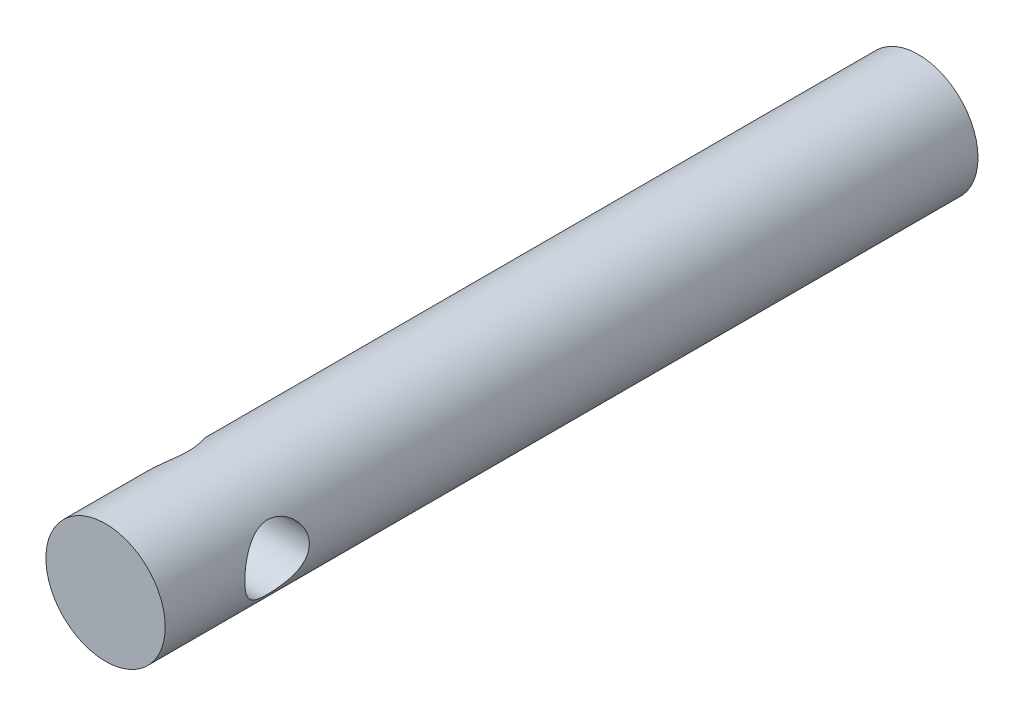
from build123d import *

# Parameters (mm, degrees)
SKETCH1_R           = 4
BOSS_EXTRUDE1_DEPTH = 54.5
SKETCH2_R           = 2.165
CUT_EXTRUDE1_DEPTH  = 9
SKETCH4_R           = 3.5
CUT_EXTRUDE2_DEPTH  = 55.792791611


with BuildPart() as part:
    # Sketch1 → Boss-Extrude1 (new body)
    with BuildSketch(Plane.XY):
        Circle(SKETCH1_R)
    extrude(amount=BOSS_EXTRUDE1_DEPTH)

    # Sketch2 → Cut-Extrude1 (cut, symmetric)
    with BuildSketch(Plane(origin=(0, 0, 0), x_dir=(0, 0, -1), z_dir=(1, 0, 0))):
        with Locations((-47, 0)):
            Circle(SKETCH2_R)
    extrude(amount=CUT_EXTRUDE1_DEPTH, both=True, mode=Mode.SUBTRACT)

    # Sketch4 → Cut-Extrude2 (cut, through all)
    with BuildSketch(Plane(origin=(0, 0, 0), x_dir=(0, 0, -1), z_dir=(1, 0, 0))):
        with Locations((-47, 0)):
            Circle(SKETCH4_R)
    extrude(amount=-CUT_EXTRUDE2_DEPTH, mode=Mode.SUBTRACT)


solid = part.part
